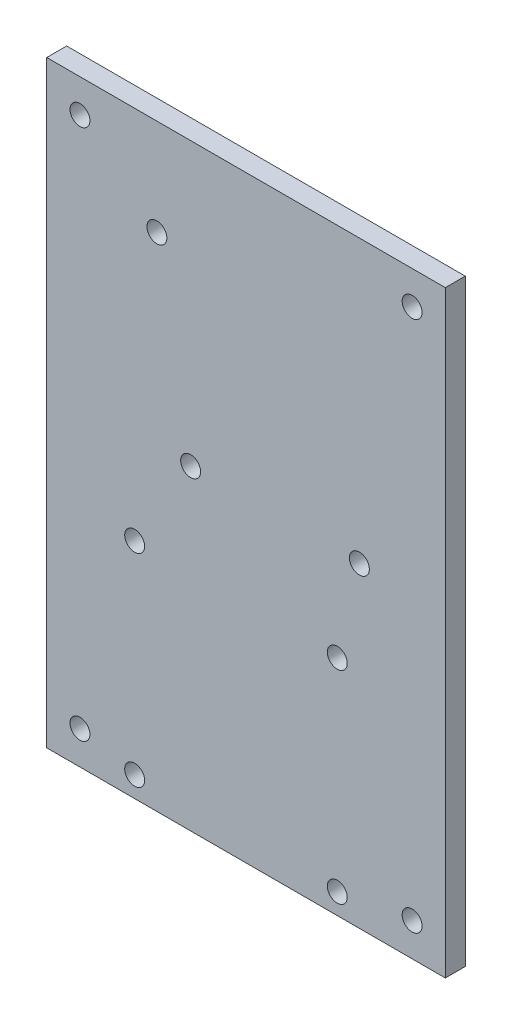
from build123d import *

# Parameters (mm, degrees)
SKETCH1_W           = 60
SKETCH1_H           = 90
BOSS_EXTRUDE1_DEPTH = 3
SKETCH2_R           = 1.5
CUT_EXTRUDE1_DEPTH  = 3
SKETCH3_R           = 1.5
CUT_EXTRUDE2_DEPTH  = 3
SKETCH4_R           = 1.5
CUT_EXTRUDE3_DEPTH  = 55.166410256


with BuildPart() as part:
    # Sketch1 → Boss-Extrude1 (new body)
    with BuildSketch(Plane.XY):
        Rectangle(SKETCH1_W, SKETCH1_H)
    extrude(amount=-BOSS_EXTRUDE1_DEPTH)

    # Sketch2 → Cut-Extrude1 (cut)
    with BuildSketch(Plane.XY):
        with Locations((-25, 40)):
            Circle(SKETCH2_R)
        with Locations((-25, -40)):
            Circle(SKETCH2_R)
        with Locations((25, -40)):
            Circle(SKETCH2_R)
        with Locations((25, 40)):
            Circle(SKETCH2_R)
    extrude(amount=-CUT_EXTRUDE1_DEPTH, mode=Mode.SUBTRACT)

    # Sketch3 → Cut-Extrude2 (cut)
    with BuildSketch(Plane.XY):
        with Locations((-13.42, 30.5)):
            Circle(SKETCH3_R)
        with Locations((-8.34, 2.56)):
            Circle(SKETCH3_R)
        with Locations((17.06, 2.56)):
            Circle(SKETCH3_R)
    extrude(amount=-CUT_EXTRUDE2_DEPTH, mode=Mode.SUBTRACT)

    # Sketch4 → Cut-Extrude3 (cut, through all)
    with BuildSketch(Plane.XY):
        with Locations((-16.762789551, -41.88018292)):
            Circle(SKETCH4_R)
        with Locations((-16.762789551, -11.38018292)):
            Circle(SKETCH4_R)
        with Locations((13.737210449, -41.88018292)):
            Circle(SKETCH4_R)
        with Locations((13.737210449, -11.38018292)):
            Circle(SKETCH4_R)
    extrude(amount=-CUT_EXTRUDE3_DEPTH, mode=Mode.SUBTRACT)


solid = part.part
